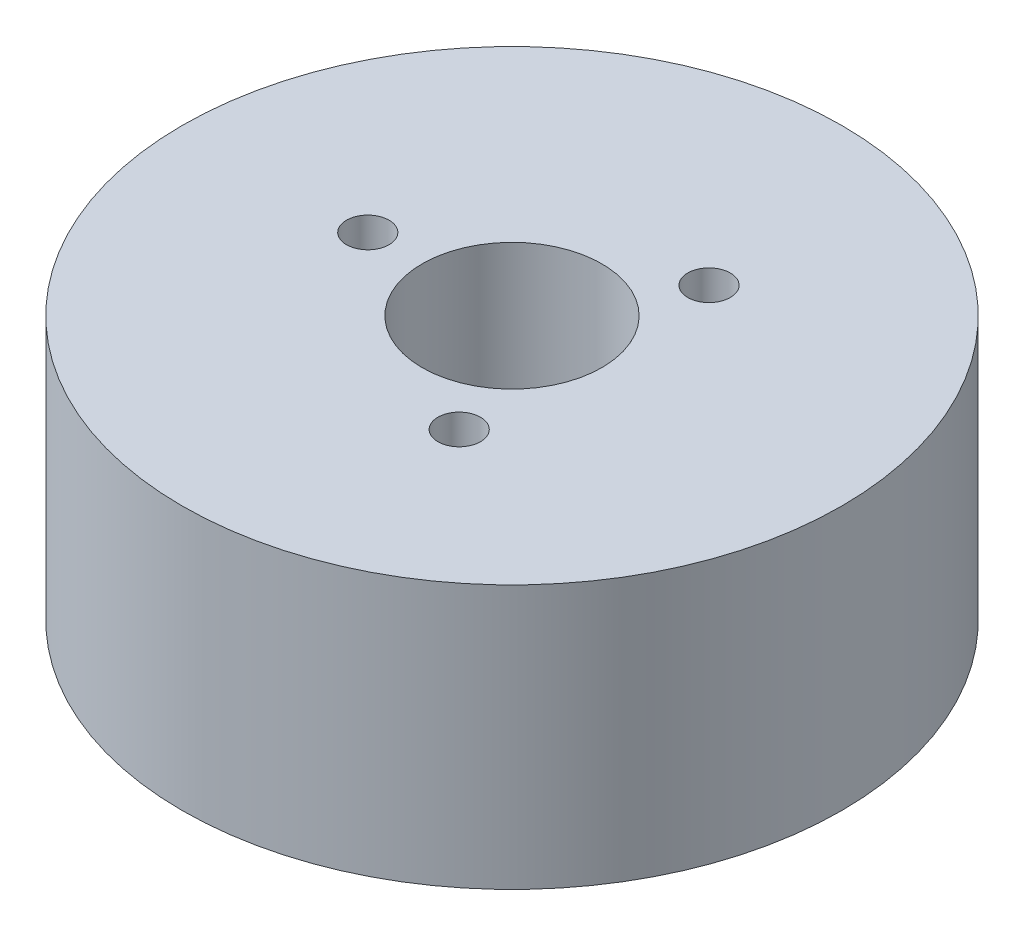
from build123d import *

# Parameters (mm, degrees)
SKETCH1_R           = 27.5
BOSS_EXTRUDE1_DEPTH = 22
SKETCH2_R           = 7.5
CUT_EXTRUDE1_DEPTH  = 45.682211225
SKETCH3_R           = 1.775343976
CUT_EXTRUDE2_DEPTH  = 20.387352892
CIRPATTERN1_COUNT   = 3


with BuildPart() as part:
    # Sketch1 → Boss-Extrude1 (new body)
    with BuildSketch(Plane(origin=(0, 0, 0), x_dir=(1, 0, 0), z_dir=(0, 1, 0))):
        Circle(SKETCH1_R)
    extrude(amount=BOSS_EXTRUDE1_DEPTH)

    # Sketch2 → Cut-Extrude1 (cut, through all)
    with BuildSketch(Plane(origin=(0, 0, 0), x_dir=(1, 0, 0), z_dir=(0, 1, 0))):
        Circle(SKETCH2_R)
    extrude(amount=CUT_EXTRUDE1_DEPTH, mode=Mode.SUBTRACT)

    # Sketch3 → Cut-Extrude2 (cut)
    with BuildSketch(Plane(origin=(0, 22, 0), x_dir=(1, 0, 0), z_dir=(0, 1, 0))):
        with Locations((-12.028975457, 0)):
            Circle(SKETCH3_R)
    cut_extrude2 = extrude(amount=-CUT_EXTRUDE2_DEPTH, mode=Mode.SUBTRACT)

    # CirPattern1: Cut-Extrude2 ×3 about axis
    cirpattern1_axis = Axis((0, 0, 0), (0, 1, 0))
    for i in range(1, CIRPATTERN1_COUNT):
        add(cut_extrude2.rotate(cirpattern1_axis, i * 360 / CIRPATTERN1_COUNT), mode=Mode.SUBTRACT)


solid = part.part
